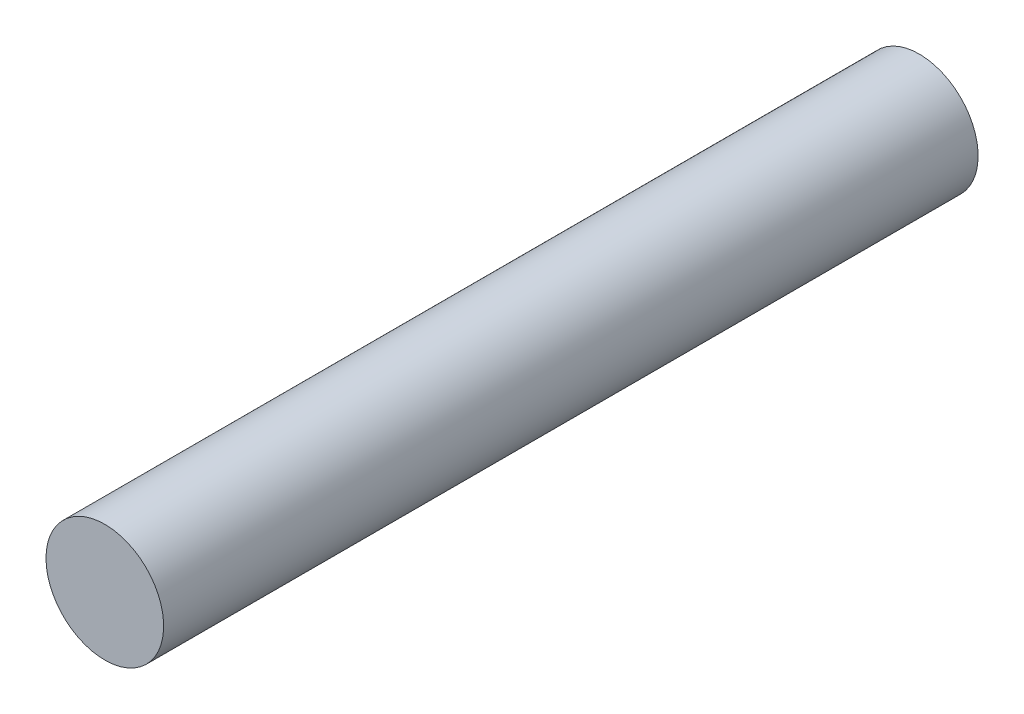
from build123d import *

# Parameters (mm, degrees)
SKETCH_1_R      = 6.5
EXTRUDE_1_DEPTH = 90


with BuildPart() as part:
    # Эскиз1 → Бобышка-Вытянуть1 (new body)
    with BuildSketch(Plane.XY):
        Circle(SKETCH_1_R)
    extrude(amount=EXTRUDE_1_DEPTH)


solid = part.part
